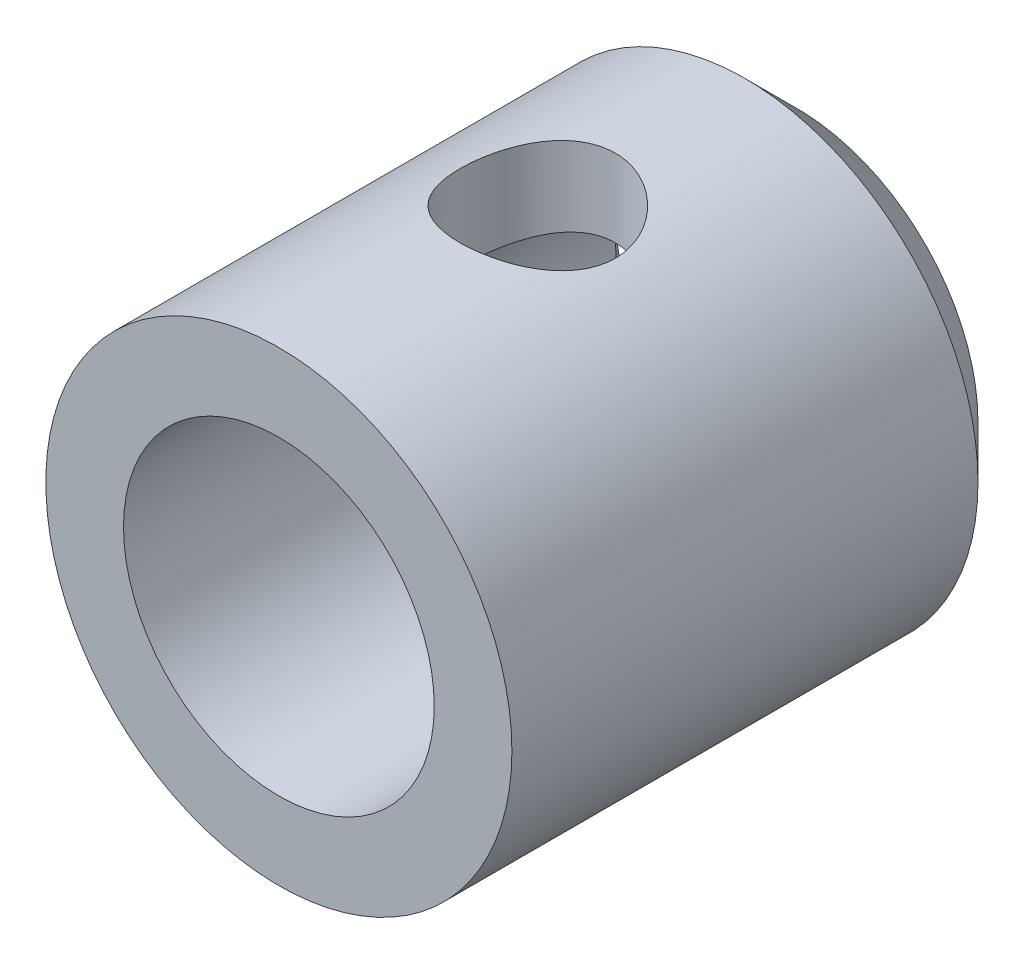
from build123d import *

# Parameters (mm, degrees)
ESQUISSE1_R                  = 9
ESQUISSE1_R_2                = 6
BASE_EXTRUSION_DEPTH         = 20
CHANFREIN1_SIZE              = 2
ENL_V_MAT_EXTRU_1_DEPTH      = 20
ENL_V_MAT_EXTRU_1_DEPTH_BACK = 24.706539182
ESQUISSE2_R                  = 3
CHANFREIN2_SIZE              = 1


with BuildPart() as part:
    # Esquisse1 → Base-Extrusion (new body)
    with BuildSketch(Plane.XY):
        Circle(ESQUISSE1_R)
        Circle(ESQUISSE1_R_2, mode=Mode.SUBTRACT)
    extrude(amount=BASE_EXTRUSION_DEPTH)

    # Chanfrein1
    chanfrein1_edges = [part.edges().sort_by_distance(p)[0] for p in [
        (-9, 0, 0),
    ]]
    chamfer(chanfrein1_edges, length=CHANFREIN1_SIZE - 0.0001)  # a hair under: the kernel refuses the full size

    # Esquisse2 → Enlèv. mat.-Extru.1 (cut, two sides: drawn at the far end of the back side and taken through both)
    with BuildSketch(Plane(origin=(0, 0, 0), x_dir=(1, 0, 0), z_dir=(0, 1, 0)).offset(-ENL_V_MAT_EXTRU_1_DEPTH_BACK)):
        with Locations(Location((0, -10, 0), (0, 0, 270))):
            Circle(ESQUISSE2_R)
    extrude(amount=ENL_V_MAT_EXTRU_1_DEPTH + ENL_V_MAT_EXTRU_1_DEPTH_BACK, mode=Mode.SUBTRACT)

    # Chanfrein2
    chanfrein2_edges = [part.edges().sort_by_distance(p)[0] for p in [
        (-6, 0, 0),
    ]]
    chamfer(chanfrein2_edges, length=CHANFREIN2_SIZE)


solid = part.part
